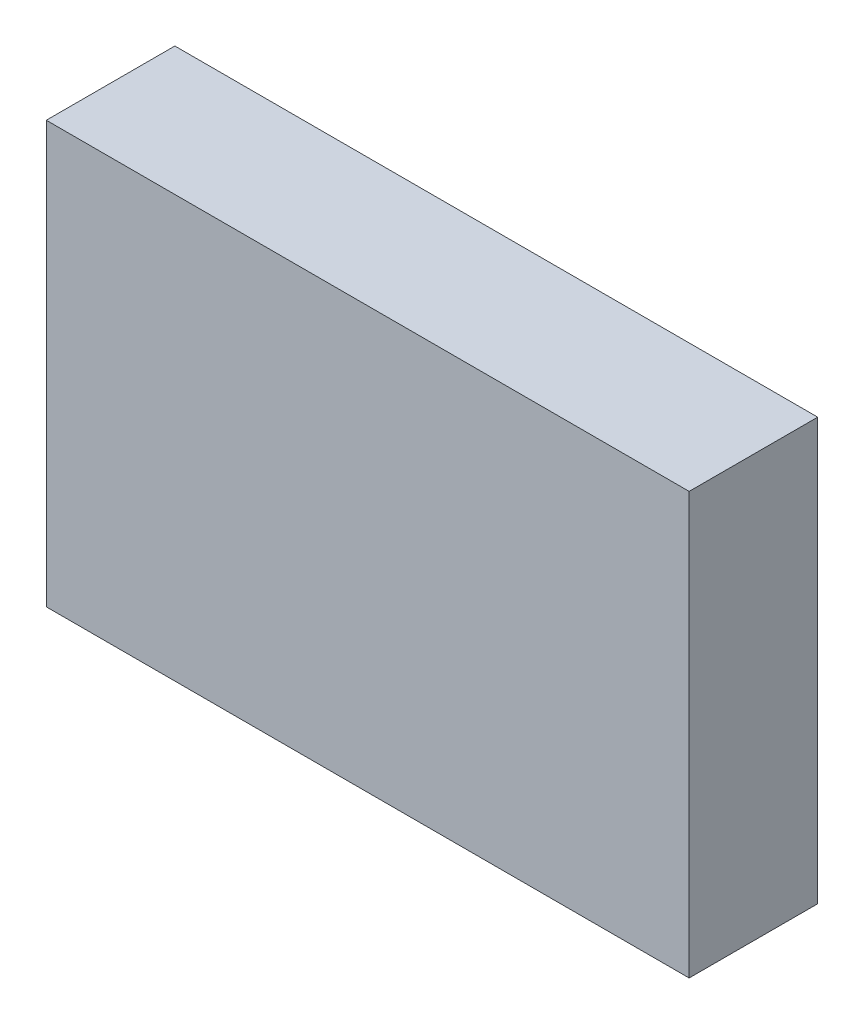
from build123d import *

# Parameters (mm, degrees)
ESQUISSE1_W        = 90
ESQUISSE1_H        = 59
BOSS_EXTRU_1_DEPTH = 18


with BuildPart() as part:
    # Esquisse1 → Boss.-Extru.1 (new body)
    with BuildSketch(Plane.XY):
        with Locations((45, 29.5)):
            Rectangle(ESQUISSE1_W, ESQUISSE1_H)
    extrude(amount=BOSS_EXTRU_1_DEPTH)


solid = part.part
